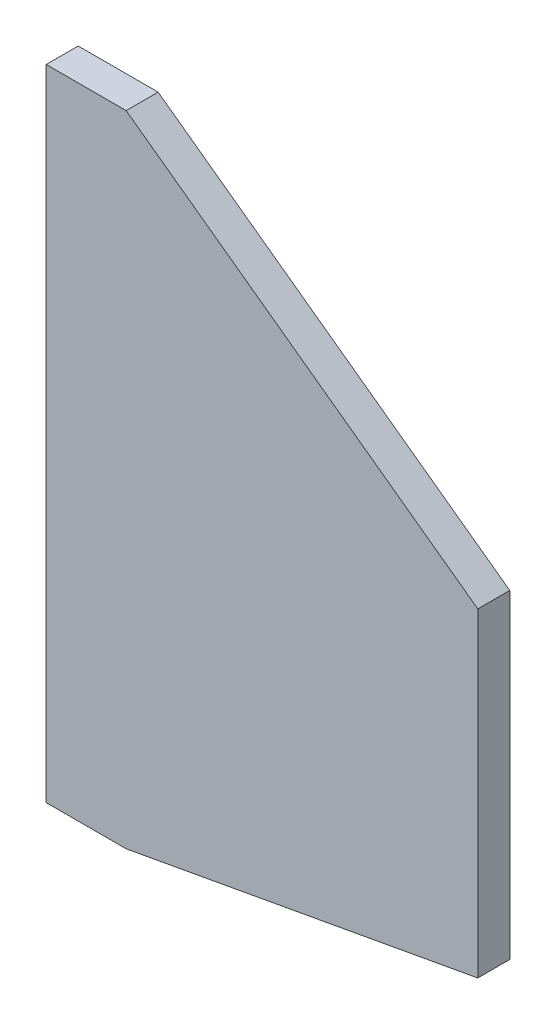
from build123d import *

# Parameters (mm, degrees)
BOSS_EXTRUDE1_DEPTH = 5.08


with BuildPart() as part:
    # Sketch2 → Boss-Extrude1 (new body)
    with BuildSketch(Plane.XY):
        Polygon((0, 0), (12.7, 0), (68.58, 10.16), (68.58, 60.96), (12.7, 101.6), (0, 101.6), align=None)
    extrude(amount=BOSS_EXTRUDE1_DEPTH)


solid = part.part
